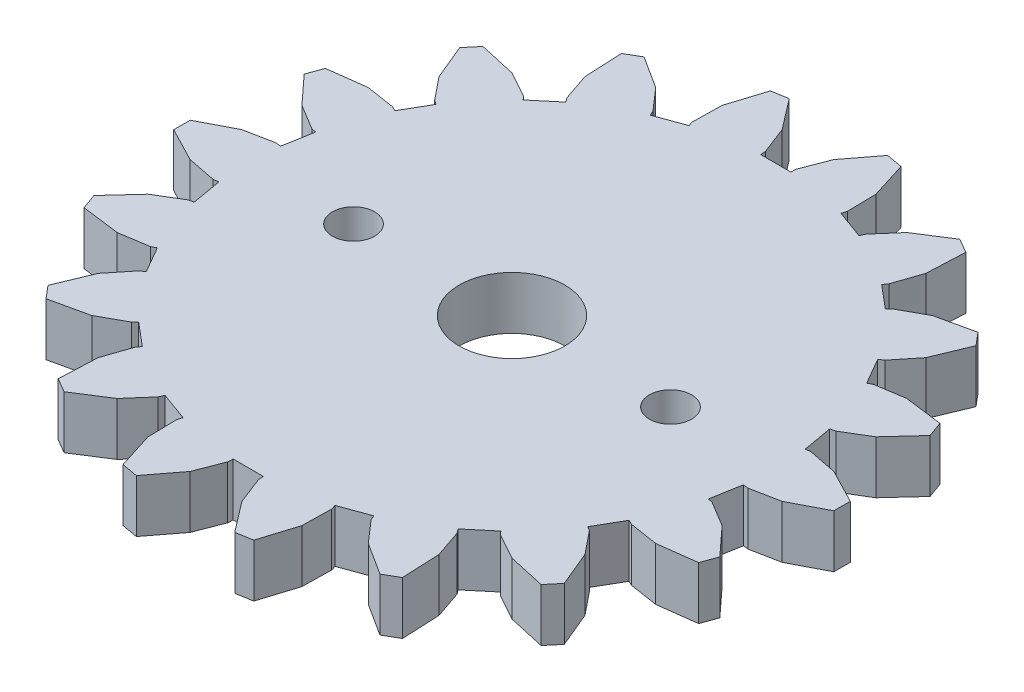
from build123d import *

# Parameters (mm, degrees)
BOSS_EXTRUDE1_DEPTH = 4
CUT_EXTRUDE1_REACH  = 75.812
SKETCH3_R           = 4
SKETCH3_R_2         = 1.6


with BuildPart() as part:
    # Sketch2 → Boss-Extrude1 (new body)
    with BuildSketch(Plane(origin=(0, 0, 0), x_dir=(1, 0, 0), z_dir=(0, 1, 0))):
        Polygon((47.762485652, 28.947762614), (48.151644834, 28.993511507), (50.314204979, 28.569206144), (52.891842509, 27.230711864), (52.891842509, 25.985875569), (50.314204979, 24.64738129), (48.151644834, 24.223075927), (47.762485652, 24.26882482), (47.364687765, 22.01339285), (47.746189201, 21.923269799), (49.633078836, 20.785048503), (51.597722388, 18.645460901), (51.171846794, 17.475628356), (48.291639591, 17.099624468), (46.114549418, 17.440482175), (45.764463734, 17.616604769), (44.61937085, 15.633112183), (44.946877072, 15.41811298), (46.330727164, 13.703026236), (47.445189759, 11.020736322), (46.644881204, 10.066885332), (43.809638126, 10.698728344), (41.880533139, 11.763515425), (41.611734913, 12.048806991), (39.857182288, 10.576600966), (40.091620493, 10.26244623), (40.805339538, 8.177638611), (40.935124663, 5.276029792), (39.856986096, 4.653415452), (37.408741307, 6.216726184), (35.960097095, 7.877228441), (35.80517923, 8.237328261), (33.65302491, 7.453905429), (33.765728119, 7.078490812), (33.723317272, 4.875286939), (32.852913242, 2.104248708), (31.626729093, 1.888070961), (29.860985181, 4.194160796), (29.0677451, 6.250105246), (29.045164941, 6.64142393), (26.754979175, 6.64142393), (26.732399712, 6.250105246), (25.939159631, 4.194160796), (24.173415719, 1.888070961), (22.947231569, 2.104248708), (22.07682754, 4.875286939), (22.034416692, 7.078490812), (22.147119206, 7.453905429), (19.994964886, 8.237328261), (19.840047716, 7.877228441), (18.391403505, 6.216726184), (15.943158715, 4.653415452), (14.865019453, 5.276029792), (14.994804578, 8.177638611), (15.708524319, 10.26244623), (15.942961828, 10.576600966), (14.188409899, 12.048806991), (13.919610977, 11.763515425), (11.990506685, 10.698728344), (9.155262912, 10.066885332), (8.354954357, 11.020736322), (9.469417647, 13.703026236), (10.85326774, 15.41811298), (11.180773961, 15.633112183), (10.035681078, 17.616604769), (9.685594698, 17.440482175), (7.508504525, 17.099624468), (4.628298017, 17.475628356), (4.202422424, 18.645460901), (6.16706528, 20.785048503), (8.053955611, 21.923269799), (8.435457047, 22.01339285), (8.037658464, 24.26882482), (7.648499977, 24.223075927), (5.485939137, 24.64738129), (2.908302302, 25.985875569), (2.908302302, 27.230711864), (5.485939137, 28.569206144), (7.648499977, 28.993511507), (8.037658464, 28.947762614), (8.435457047, 31.203194583), (8.053955611, 31.293317634), (6.16706528, 32.431538931), (4.202422424, 34.571126533), (4.628298017, 35.740959077), (7.508504525, 36.116962965), (9.685594698, 35.776105258), (10.035681078, 35.599982665), (11.180773961, 37.583475251), (10.85326774, 37.798474454), (9.469417647, 39.513561197), (8.354954357, 42.195851112), (9.155262912, 43.149702102), (11.990506685, 42.517859089), (13.919610977, 41.453072008), (14.188409899, 41.167780443), (15.942961828, 42.639986468), (15.708524319, 42.954141203), (14.994804578, 45.038948823), (14.865019453, 47.940557642), (15.943158715, 48.563171981), (18.391403505, 46.99986125), (19.840047716, 45.339358993), (19.994964886, 44.979259173), (22.147119206, 45.762682005), (22.034416692, 46.138096622), (22.07682754, 48.341300495), (22.947231569, 51.112338726), (24.173415719, 51.328516472), (25.939159631, 49.022426638), (26.732399712, 46.966482188), (26.754979175, 46.575163503), (29.045164941, 46.575163503), (29.0677451, 46.966482188), (29.860985181, 49.022426638), (31.626729093, 51.328516472), (32.852913242, 51.112338726), (33.723317272, 48.341300495), (33.765728119, 46.138096622), (33.65302491, 45.762682005), (35.80517923, 44.979259173), (35.960097095, 45.339358993), (37.408741307, 46.99986125), (39.856986096, 48.563171981), (40.935124663, 47.940557642), (40.805339538, 45.038948823), (40.091620493, 42.954141203), (39.857182288, 42.639986468), (41.611734913, 41.167780443), (41.880533139, 41.453072008), (43.809638126, 42.517859089), (46.644881204, 43.149702102), (47.445189759, 42.195851112), (46.330727164, 39.513561197), (44.946877072, 37.798474454), (44.61937085, 37.583475251), (45.764463734, 35.599982665), (46.114549418, 35.776105258), (48.291639591, 36.116962965), (51.171846794, 35.740959077), (51.597722388, 34.571126533), (49.633078836, 32.431538931), (47.746189201, 31.293317634), (47.364687765, 31.203194583), align=None)
    extrude(amount=BOSS_EXTRUDE1_DEPTH)

    # Sketch3 → Cut-Extrude1 (cut, up to next)
    with BuildSketch(Plane(origin=(0, 0, 0), x_dir=(1, 0, 0), z_dir=(0, 1, 0)), mode=Mode.PRIVATE) as cut_extrude1_sk1:
        with Locations((27.900072058, 26.608293717)):
            Circle(SKETCH3_R)
    cut_extrude1_tool1 = extrude(cut_extrude1_sk1.sketch, amount=CUT_EXTRUDE1_REACH, mode=Mode.PRIVATE) & part.part
    # Sketch3 → Cut-Extrude1 (cut, up to next)
    with BuildSketch(Plane(origin=(0, 0, 0), x_dir=(1, 0, 0), z_dir=(0, 1, 0)), mode=Mode.PRIVATE) as cut_extrude1_sk2:
        with Locations((15.900072058, 26.608293717)):
            Circle(SKETCH3_R_2)
    cut_extrude1_tool2 = extrude(cut_extrude1_sk2.sketch, amount=CUT_EXTRUDE1_REACH, mode=Mode.PRIVATE) & part.part
    # Sketch3 → Cut-Extrude1 (cut, up to next)
    with BuildSketch(Plane(origin=(0, 0, 0), x_dir=(1, 0, 0), z_dir=(0, 1, 0)), mode=Mode.PRIVATE) as cut_extrude1_sk3:
        with Locations((39.900072058, 26.608293717)):
            Circle(SKETCH3_R_2)
    cut_extrude1_tool3 = extrude(cut_extrude1_sk3.sketch, amount=CUT_EXTRUDE1_REACH, mode=Mode.PRIVATE) & part.part
    add(cut_extrude1_tool1.solids().sort_by_distance((27.900072, 0, -26.608294))[0], mode=Mode.SUBTRACT)
    add(cut_extrude1_tool2.solids().sort_by_distance((15.900072, 0, -26.608294))[0], mode=Mode.SUBTRACT)
    add(cut_extrude1_tool3.solids().sort_by_distance((39.900072, 0, -26.608294))[0], mode=Mode.SUBTRACT)


solid = part.part
